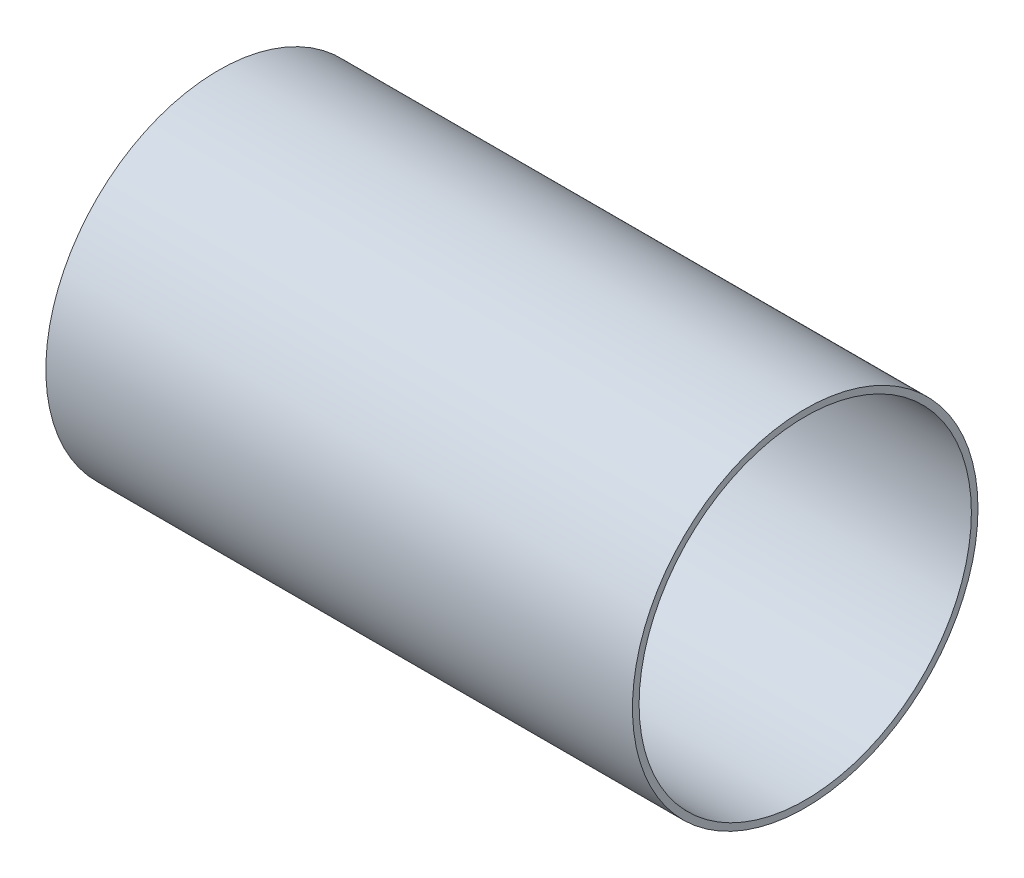
from build123d import *

# Parameters (mm, degrees)
SKETCH1_R           = 21.844
SKETCH1_R_2         = 21.0058
BOSS_EXTRUDE1_DEPTH = 74.168


with BuildPart() as part:
    # Sketch1 → Boss-Extrude1 (new body)
    with BuildSketch(Plane(origin=(0, 0, 0), x_dir=(0, 0, -1), z_dir=(1, 0, 0))):
        Circle(SKETCH1_R)
        Circle(SKETCH1_R_2, mode=Mode.SUBTRACT)
    extrude(amount=BOSS_EXTRUDE1_DEPTH)


solid = part.part
